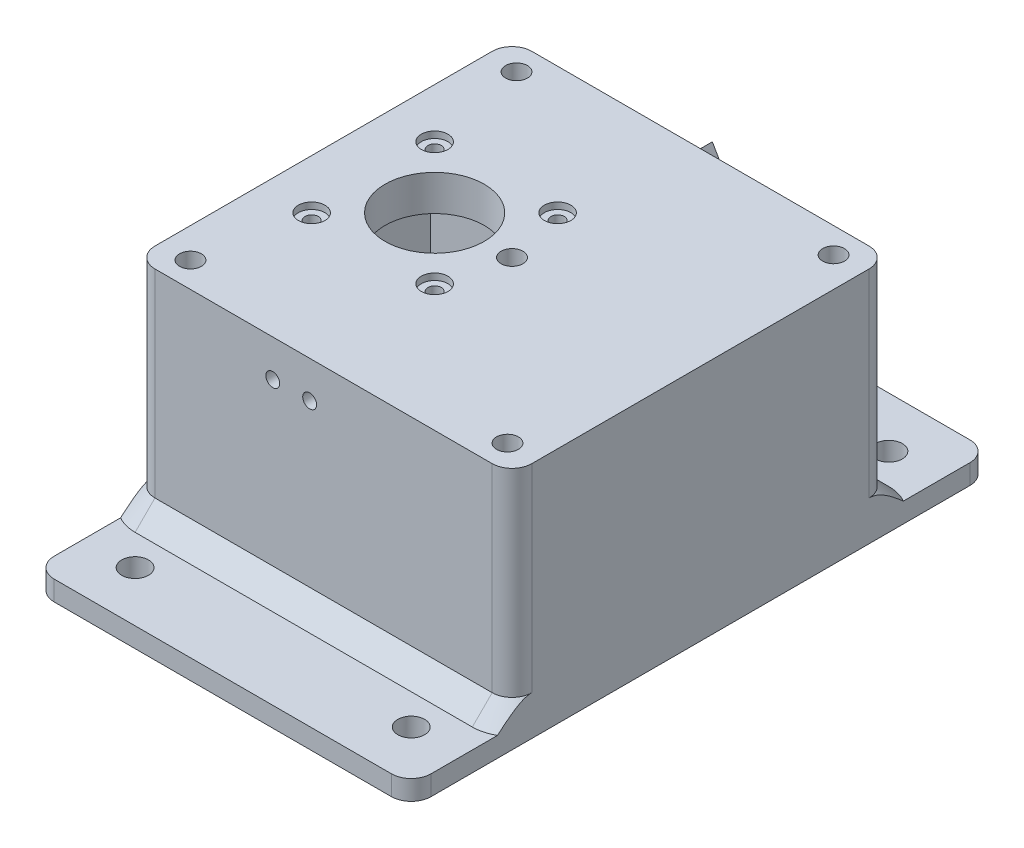
from build123d import *

# Parameters (mm, degrees)
SKETCH1_W                        = 95
SKETCH1_H                        = 95
BOSS_EXTRUDE1_DEPTH              = 60
SKETCH2_W                        = 95
SKETCH2_H                        = 5
BOSS_EXTRUDE2_DEPTH              = 25.4
FILLET1_R                        = 5
F_1_4_CLEARANCE_HOLE1_AT_2_COUNT = 2
F_1_4_CLEARANCE_HOLE1_AT_2_PITCH = 69.6
BOSS_EXTRUDE3_DEPTH              = 3
CHAMFER1_SIZE                    = 5
CHAMFER1_SIZE_2                  = 3.004303095
SKETCH6_W                        = 50
SKETCH6_H                        = 44
CUT_EXTRUDE1_DEPTH               = 51
SKETCH6_3_R                      = 12.5
CUT_EXTRUDE2_DEPTH               = 106.69134307
SKETCH7_W                        = 5
SKETCH7_H                        = 44
BOSS_EXTRUDE4_DEPTH              = 27
SKETCH8_W                        = 5
SKETCH8_H                        = 12.5
BOSS_EXTRUDE5_DEPTH              = 24
CBORE_FOR_M3_SBHCS1_D            = 3.4
CBORE_FOR_M3_SBHCS1_CBORE_D      = 6.7
CBORE_FOR_M3_SBHCS1_CBORE_DEPTH  = 1.65
CHAMFER2_SIZE                    = 5
CHAMFER3_SIZE                    = 5
F_6_0MM_DOWEL_HOLE1_D            = 5.5
F_6_0MM_DOWEL_HOLE1_DEPTH        = 12
F_6_0MM_DOWEL_HOLE1_TIP          = 1.652366702
F_3_0MM_DOWEL_HOLE1_D            = 3.5
F_3_0MM_DOWEL_HOLE1_DEPTH        = 12
F_3_0MM_DOWEL_HOLE1_TIP          = 1.051506083


with BuildPart() as part:
    # Sketch1 → Boss-Extrude1 (new body)
    with BuildSketch(Plane(origin=(0, 0, 0), x_dir=(1, 0, 0), z_dir=(0, 1, 0))):
        Rectangle(SKETCH1_W, SKETCH1_H)
    extrude(amount=BOSS_EXTRUDE1_DEPTH)

    # Sketch2 → Boss-Extrude2 (add)
    with BuildSketch(Plane.XY.offset(47.5)):
        with Locations((0, 2.5)):
            Rectangle(SKETCH2_W, SKETCH2_H)
    boss_extrude2 = extrude(amount=BOSS_EXTRUDE2_DEPTH)

    # Mirror1: Boss-Extrude2 across plane
    add(boss_extrude2.mirror(Plane.XY))

    # Fillet1
    fillet1_edges = [part.edges().sort_by_distance(p)[0] for p in [
        (-47.5, 2.5, 72.9),
        (47.5, 2.5, 72.9),
        (-47.5, 2.5, -72.9),
        (47.5, 2.5, -72.9),
        (47.5, 32.5, 47.5),
        (-47.5, 32.5, 47.5),
        (-47.5, 32.5, -47.5),
        (47.5, 32.5, -47.5),
    ]]
    fillet(fillet1_edges, radius=FILLET1_R)

    # Sketch4 → 1/4 Clearance Hole1 (revolve, cut)
    with BuildSketch(Plane(origin=(34.8, 5, 60.2), x_dir=(0, 0, 1), z_dir=(1, 0, 0))):
        Polygon((0, 0), (0, 12.029827343), (3.3782, 10), (3.3782, 0), align=None)
    f_1_4_clearance_hole1 = revolve(axis=Axis((34.8, 11.35, 60.2), (0, -1, 0)), mode=Mode.SUBTRACT)

    # 1/4 Clearance Hole1 at 2: 1/4 Clearance Hole1 ×2
    with Locations(*[(-i * F_1_4_CLEARANCE_HOLE1_AT_2_PITCH, 0, 0) for i in range(1, F_1_4_CLEARANCE_HOLE1_AT_2_COUNT)]):
        add(f_1_4_clearance_hole1, mode=Mode.SUBTRACT)

    # Mirror2: 1/4 Clearance Hole1 across plane
    add(f_1_4_clearance_hole1.mirror(Plane.XY), mode=Mode.SUBTRACT)

    # Mirror2 copy 1 sketch → Mirror2 copy 1 (revolve, cut)
    with BuildSketch(Plane(origin=(-34.8, 5, -60.2), x_dir=(0, 0, -1), z_dir=(1, 0, 0))):
        Polygon((0, 0), (0, -12.029827343), (3.3782, -10), (3.3782, 0), align=None)
    revolve(axis=Axis((-34.8, 11.35, -60.2), (0, 1, 0)), mode=Mode.SUBTRACT)

    # Sketch5 → Boss-Extrude3 (add)
    with BuildSketch(Plane(origin=(0, 0, -47.5), x_dir=(-1, 0, 0), z_dir=(0, 0, -1))):
        Polygon((0, 60), (-2.886751346, 55), (2.886751346, 55), align=None)
    extrude(amount=BOSS_EXTRUDE3_DEPTH)

    # Chamfer1
    # the kernel refuses this chamfer: 5, 3.004303095 mm, written as the material it adds along each edge
    with BuildSketch(Plane(origin=(15.817899449, 55, -47.5), x_dir=(0, -0.9998016840798124, 0.01991463058083395), z_dir=(-1, 0, 0))) as chamfer1_piece_1_section:
        Polygon((CHAMFER1_SIZE * 0.99980168408, -CHAMFER1_SIZE * 0.0199146305808), (-CHAMFER1_SIZE_2 * 0.0199146305817, -CHAMFER1_SIZE_2 * 0.999801684126), (0, 0), align=None)
    chamfer1_piece_1 = extrude(amount=31.635798898, mode=Mode.PRIVATE)
    chamfer1_piece_1 = split(chamfer1_piece_1, bisect_by=Plane(origin=(-2.998221353, 54.806928285, -48.382310959), z_dir=(0.8660254037844363, -0.5000000000000041, 0)), keep=Keep.TOP, mode=Mode.PRIVATE)
    chamfer1_piece_1 = split(chamfer1_piece_1, bisect_by=Plane(origin=(2.998221353, 54.806928285, -48.382310959), z_dir=(-0.8660254037844365, -0.5000000000000039, 0)), keep=Keep.TOP, mode=Mode.PRIVATE)
    chamfer1_piece_1 = split(chamfer1_piece_1, bisect_by=Plane(origin=(0, 53.07590438, -50.5), z_dir=(0, 0, 1)), keep=Keep.TOP, mode=Mode.PRIVATE)
    add(chamfer1_piece_1)

    # Sketch6 → Cut-Extrude1 (cut)
    with BuildSketch(Plane.XZ):
        with Locations((-22.5, 0)):
            Rectangle(SKETCH6_W, SKETCH6_H)
    extrude(amount=-CUT_EXTRUDE1_DEPTH, mode=Mode.SUBTRACT)

    # Sketch6<3> → Cut-Extrude2 (cut, through all)
    with BuildSketch(Plane.XZ):
        with Locations(Location((-19.5, 0, 0), (0, 0, 270))):
            Circle(SKETCH6_3_R)
    extrude(amount=-CUT_EXTRUDE2_DEPTH, mode=Mode.SUBTRACT)

    # Sketch7 → Boss-Extrude4 (add)
    with BuildSketch(Plane.XZ.offset(-51)):
        with Locations((-45, 0)):
            Rectangle(SKETCH7_W, SKETCH7_H)
    extrude(amount=BOSS_EXTRUDE4_DEPTH)

    # Sketch8 → Boss-Extrude5 (add)
    with BuildSketch(Plane.XZ.offset(-24)):
        with Locations((-45, -15.75)):
            Rectangle(SKETCH8_W, SKETCH8_H)
        with Locations((-45, 15.75)):
            Rectangle(SKETCH8_W, SKETCH8_H)
    extrude(amount=BOSS_EXTRUDE5_DEPTH)

    # CBORE for M3 SBHCS1 (through all)
    with Locations(Plane(origin=(0, 60, 0), x_dir=(1, 0, 0), z_dir=(0, 1, 0))):
        with Locations((-19.5, 0), (-4, -15.5), (-35, 15.5), (-35, -15.5), (-4, 15.5)):
            CounterBoreHole(CBORE_FOR_M3_SBHCS1_D / 2, CBORE_FOR_M3_SBHCS1_CBORE_D / 2, CBORE_FOR_M3_SBHCS1_CBORE_DEPTH)

    # Chamfer2
    # the kernel refuses this chamfer: 5 mm, written as the material it adds along each edge
    with BuildSketch(Plane(origin=(42.5, 5, -47.5), x_dir=(0, 0.9996219169112969, 0.0274958766105808), z_dir=(-1, 0, 0))) as chamfer2_piece_1:
        Polygon((CHAMFER2_SIZE * 0.999621916911, CHAMFER2_SIZE * 0.0274958766106), (-CHAMFER2_SIZE * 0.0274958766106, CHAMFER2_SIZE * 0.999621916911), (0, 0), align=None)
    extrude(amount=85)
    with BuildSketch(Plane(origin=(42.5, 5, 47.5), x_dir=(0, 0.9996219169112968, -0.027495876610586324), z_dir=(-1, 0, 0))) as chamfer2_piece_2:
        Polygon((CHAMFER2_SIZE * 0.999621916911, -CHAMFER2_SIZE * 0.0274958766106), (-CHAMFER2_SIZE * 0.0274958766106, -CHAMFER2_SIZE * 0.999621916911), (0, 0), align=None)
    extrude(amount=85)
    with BuildSketch(Plane(origin=(-42.5, 5, 42.5), x_dir=(0, 0, 1), z_dir=(1, 0, 0))) as chamfer2_piece_3_section:
        Polygon((5, -CHAMFER2_SIZE), (5 + CHAMFER2_SIZE, 0), (5, 0), align=None)
    chamfer2_piece_3 = revolve(axis=Axis((-42.5, 5, 42.5), (0, -1, 0)), revolution_arc=237.405771779, mode=Mode.PRIVATE)
    chamfer2_piece_3 = split(chamfer2_piece_3, bisect_by=Plane(origin=(-47.5, 7.211903133, 46.338242127), z_dir=(1, 0, 0)), keep=Keep.TOP, mode=Mode.PRIVATE)
    add(chamfer2_piece_3)
    with BuildSketch(Plane(origin=(42.5, 5, 42.5), x_dir=(0, 0, 1), z_dir=(-1, 0, 0))) as chamfer2_piece_4_section:
        Polygon((5, CHAMFER2_SIZE), (5 + CHAMFER2_SIZE, 0), (5, 0), align=None)
    chamfer2_piece_4 = revolve(axis=Axis((42.5, 5, 42.5), (0, 1, 0)), revolution_arc=237.405771779, mode=Mode.PRIVATE)
    chamfer2_piece_4 = split(chamfer2_piece_4, bisect_by=Plane(origin=(47.5, 7.211903133, 46.338242127), z_dir=(-1, 0, 0)), keep=Keep.TOP, mode=Mode.PRIVATE)
    add(chamfer2_piece_4)
    with BuildSketch(Plane(origin=(42.5, 5, -42.5), x_dir=(0, 0, -1), z_dir=(-1, 0, 0))) as chamfer2_piece_5_section:
        Polygon((5 + CHAMFER2_SIZE, 0), (5, -CHAMFER2_SIZE), (5, 0), align=None)
    chamfer2_piece_5 = revolve(axis=Axis((42.5, 5, -42.5), (0, -1, 0)), revolution_arc=237.405771779, mode=Mode.PRIVATE)
    chamfer2_piece_5 = split(chamfer2_piece_5, bisect_by=Plane(origin=(47.5, 6.474161158, -49.057149182), z_dir=(-1, 0, 0)), keep=Keep.TOP, mode=Mode.PRIVATE)
    add(chamfer2_piece_5)
    with BuildSketch(Plane(origin=(-42.5, 5, -42.5), x_dir=(0.8425066666450718, 0, 0.5386859165215014), z_dir=(0.5386859165215014, 0, -0.8425066666450718))) as chamfer2_piece_6_section:
        Polygon((5 + CHAMFER2_SIZE, 0), (5, -CHAMFER2_SIZE), (5, 0), align=None)
    chamfer2_piece_6 = revolve(axis=Axis((-42.5, 5, -42.5), (0, -1, 0)), revolution_arc=237.405771779, mode=Mode.PRIVATE)
    chamfer2_piece_6 = split(chamfer2_piece_6, bisect_by=Plane(origin=(-47.5, 7.211903133, -46.338242127), z_dir=(1, 0, 0)), keep=Keep.TOP, mode=Mode.PRIVATE)
    add(chamfer2_piece_6)

    # Chamfer3
    chamfer3_edges = [part.edges().sort_by_distance(p)[0] for p in [
        (-45, 0, -9.5),
        (-45, 0, 9.5),
    ]]
    chamfer(chamfer3_edges, length=CHAMFER3_SIZE)

    # Ø6.0mm Dowel Hole1
    with Locations(Plane(origin=(0, 60, 0), x_dir=(1, 0, 0), z_dir=(0, 1, 0))):
        with Locations((0, 0), (39.952317218, 41.093696451), (-39.952317218, -41.093696451), (-39.952317218, 41.093696451), (39.952317218, -41.093696451)):
            Hole(F_6_0MM_DOWEL_HOLE1_D / 2, depth=F_6_0MM_DOWEL_HOLE1_DEPTH)
            with Locations((0, 0, -(F_6_0MM_DOWEL_HOLE1_DEPTH + F_6_0MM_DOWEL_HOLE1_TIP / 2))):  # 118° drill point
                Cone(0, F_6_0MM_DOWEL_HOLE1_D / 2, F_6_0MM_DOWEL_HOLE1_TIP, mode=Mode.SUBTRACT)

    # Ø3.0mm Dowel Hole1
    with Locations(Plane.XY.offset(47.5)):
        with Locations((-3.5, 50.7), (-12.8, 50.7)):
            Hole(F_3_0MM_DOWEL_HOLE1_D / 2, depth=F_3_0MM_DOWEL_HOLE1_DEPTH)
            with Locations((0, 0, -(F_3_0MM_DOWEL_HOLE1_DEPTH + F_3_0MM_DOWEL_HOLE1_TIP / 2))):  # 118° drill point
                Cone(0, F_3_0MM_DOWEL_HOLE1_D / 2, F_3_0MM_DOWEL_HOLE1_TIP, mode=Mode.SUBTRACT)


solid = part.part
